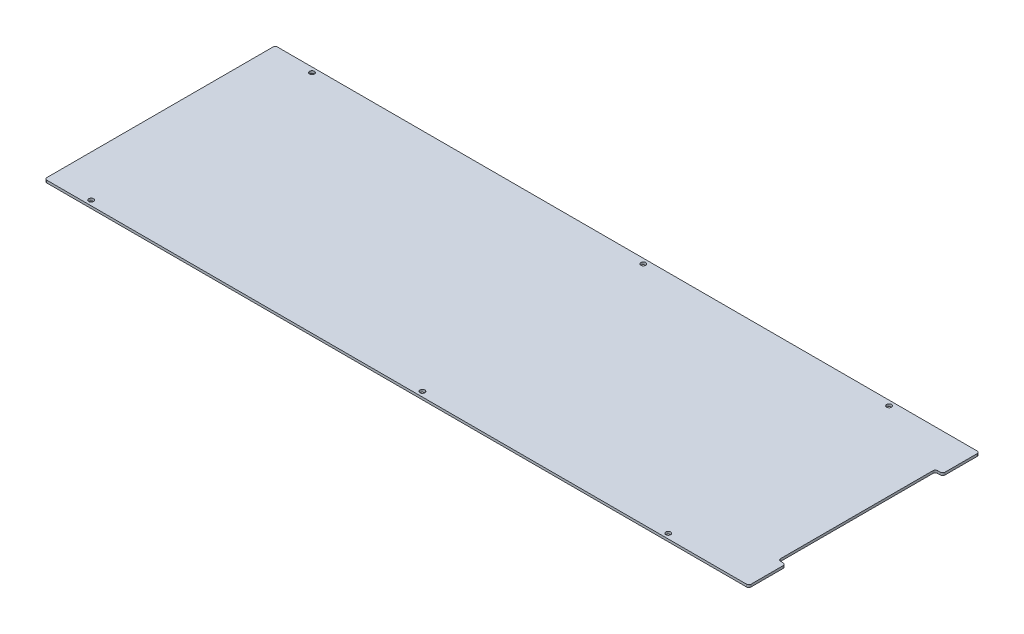
from build123d import *

# Parameters (mm, degrees)
SKETCH1_W                   = 911.225
SKETCH1_H                   = 298.45
BOSS_EXTRUDE1_DEPTH         = 3.175
SKETCH2_W                   = 9.525
SKETCH2_H                   = 203.2
CUT_EXTRUDE1_DEPTH          = 480.438141376
FILLET1_R                   = 3.175
F_1_4_0_25_DIAMETER_HOLE1_D = 6.35
FILLET2_R                   = 3.175


with BuildPart() as part:
    # Sketch1 → Boss-Extrude1 (new body)
    with BuildSketch(Plane(origin=(0, 0, 0), x_dir=(1, 0, 0), z_dir=(0, 1, 0))):
        Rectangle(SKETCH1_W, SKETCH1_H)
    extrude(amount=BOSS_EXTRUDE1_DEPTH)

    # Sketch2 → Cut-Extrude1 (cut, through all)
    with BuildSketch(Plane(origin=(0, 3.175, 0), x_dir=(1, 0, 0), z_dir=(0, 1, 0))):
        with Locations((450.85, 0)):
            Rectangle(SKETCH2_W, SKETCH2_H)
    extrude(amount=-CUT_EXTRUDE1_DEPTH, mode=Mode.SUBTRACT)

    # Fillet1
    fillet1_edges = [part.edges().sort_by_distance(p)[0] for p in [
        (446.0875, 1.5875, 101.6),
        (446.0875, 1.5875, -101.6),
    ]]
    fillet(fillet1_edges, radius=FILLET1_R)

    # 1/4 (0.25) Diameter Hole1 (through all)
    with Locations(Plane(origin=(0, 0, 0), x_dir=(-1, 0, 0), z_dir=(0, -1, 0))):
        with Locations((-345.04884, 142.875), (401.6375, 142.875), (-26.9875, 142.875)):
            f_1_4_0_25_diameter_hole1 = Hole(F_1_4_0_25_DIAMETER_HOLE1_D / 2)

    # Mirror1: 1/4 (0.25) Diameter Hole1 across plane
    add(f_1_4_0_25_diameter_hole1.mirror(Plane.XY), mode=Mode.SUBTRACT)

    # Fillet2
    fillet2_edges = [part.edges().sort_by_distance(p)[0] for p in [
        (-455.6125, 1.5875, 149.225),
        (-455.6125, 1.5875, -149.225),
        (455.6125, 1.5875, 149.225),
        (455.6125, 1.5875, 101.6),
        (455.6125, 1.5875, -101.6),
        (455.6125, 1.5875, -149.225),
    ]]
    fillet(fillet2_edges, radius=FILLET2_R)


solid = part.part
